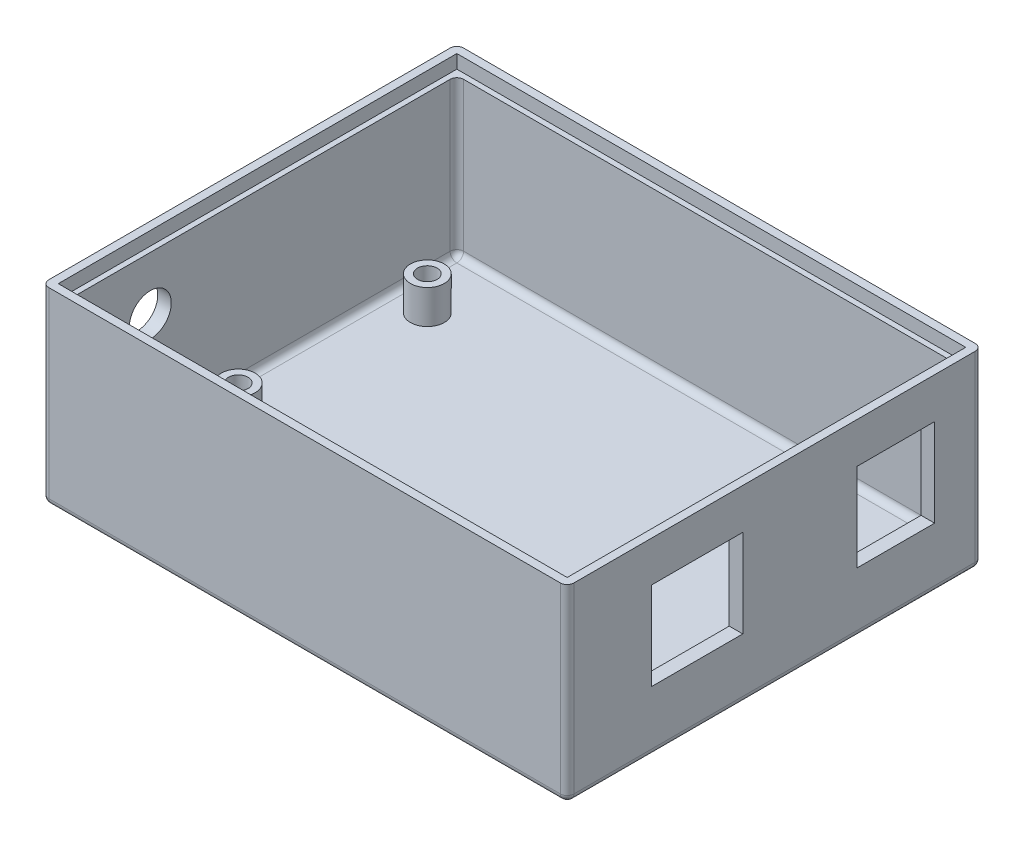
from build123d import *

# Parameters (mm, degrees)
SKETCH1_R                                         = 2.5
BOSS_EXTRUDE1_DEPTH                               = 5
BOSS_EXTRUDE1_2_DEPTH                             = 5
BOSS_EXTRUDE1_3_DEPTH                             = 5
BOSS_EXTRUDE1_4_DEPTH                             = 5
SKETCH3_W                                         = 77.6
SKETCH3_H                                         = 61.3
BOSS_EXTRUDE2_DEPTH                               = 3
SKETCH4_W                                         = 77.6
SKETCH4_H                                         = 61.3
SKETCH4_W_2                                       = 73.6
SKETCH4_H_2                                       = 57.3
BOSS_EXTRUDE3_DEPTH                               = 25
CUT_EXTRUDE2_REACH                                = 87.797
SKETCH5_W                                         = 13.5
SKETCH5_H                                         = 13
SKETCH5_W_2                                       = 11.5
FILLET1_R                                         = 1
SKETCH7_W                                         = 75.2
SKETCH7_H                                         = 58.9
CUT_EXTRUDE3_DEPTH                                = 2
SKETCH2_R                                         = 1
CUT_EXTRUDE1_DEPTH                                = 55.069053071
CSK_FOR_M2_5_FLAT_HEAD_MACHINE_SCREW1_D           = 2.9
CSK_FOR_M2_5_FLAT_HEAD_MACHINE_SCREW1_CSINK_D     = 5.5
CSK_FOR_M2_5_FLAT_HEAD_MACHINE_SCREW1_CSINK_ANGLE = 90
SKETCH12_R                                        = 3.1
CUT_EXTRUDE4_DEPTH                                = 2
FILLET3_R                                         = 1
FILLET4_R                                         = 1


with BuildPart() as part:
    # Sketch1 → Boss-Extrude1 (new body)
    with BuildSketch(Plane(origin=(0, 0, 0), x_dir=(1, 0, 0), z_dir=(0, 1, 0))):
        with Locations(Location((-32.6, 19.09, 0), (0, 0, 270))):
            Circle(SKETCH1_R)
    extrude(amount=-BOSS_EXTRUDE1_DEPTH)



with BuildPart() as body_2:
    # Sketch1 → Boss-Extrude1 2 (new body)
    with BuildSketch(Plane(origin=(0, 0, 0), x_dir=(1, 0, 0), z_dir=(0, 1, 0))):
        with Locations(Location((-32.6, -8.85, 0), (0, 0, 270))):
            Circle(SKETCH1_R)
    extrude(amount=-BOSS_EXTRUDE1_2_DEPTH)


with BuildPart() as body_3:
    # Sketch1 → Boss-Extrude1 3 (new body)
    with BuildSketch(Plane(origin=(0, 0, 0), x_dir=(1, 0, 0), z_dir=(0, 1, 0))):
        with Locations(Location((19.8, 24.15, 0), (0, 0, 270))):
            Circle(SKETCH1_R)
    extrude(amount=-BOSS_EXTRUDE1_3_DEPTH)


with BuildPart() as body_4:
    # Sketch1 → Boss-Extrude1 4 (new body)
    with BuildSketch(Plane(origin=(0, 0, 0), x_dir=(1, 0, 0), z_dir=(0, 1, 0))):
        with Locations(Location((18.5, -24.05, 0), (0, 0, 270))):
            Circle(SKETCH1_R)
    extrude(amount=-BOSS_EXTRUDE1_4_DEPTH)


with BuildPart() as part_1:
    add(part.part)

    add(body_2.part)  # Boss-Extrude2 merges body 2

    add(body_3.part)  # Boss-Extrude2 merges body 3

    add(body_4.part)  # Boss-Extrude2 merges body 4
    # Sketch3 → Boss-Extrude2 (add)
    with BuildSketch(Plane.XZ.offset(5)):
        with Locations((-1, 0)):
            Rectangle(SKETCH3_W, SKETCH3_H)
    extrude(amount=BOSS_EXTRUDE2_DEPTH)

    # Sketch4 → Boss-Extrude3 (add)
    with BuildSketch(Plane(origin=(0, -5, 0), x_dir=(1, 0, 0), z_dir=(0, 1, 0))):
        with Locations((-1, 0)):
            Rectangle(SKETCH4_W, SKETCH4_H)
        with Locations((-1, 0)):
            Rectangle(SKETCH4_W_2, SKETCH4_H_2, mode=Mode.SUBTRACT)
    extrude(amount=BOSS_EXTRUDE3_DEPTH)

    # Sketch5 → Cut-Extrude2 (cut, up to next)
    with BuildSketch(Plane(origin=(37.8, 0, 0), x_dir=(0, 0, -1), z_dir=(1, 0, 0)), mode=Mode.PRIVATE) as cut_extrude2_sk1:
        with Locations((-11.45, 7.5)):
            Rectangle(SKETCH5_W, SKETCH5_H)
    cut_extrude2_tool1 = extrude(cut_extrude2_sk1.sketch, amount=-CUT_EXTRUDE2_REACH, mode=Mode.PRIVATE) & part_1.part
    # Sketch5 → Cut-Extrude2 (cut, up to next)
    with BuildSketch(Plane(origin=(37.8, 0, 0), x_dir=(0, 0, -1), z_dir=(1, 0, 0)), mode=Mode.PRIVATE) as cut_extrude2_sk2:
        with Locations((17.9, 7.5)):
            Rectangle(SKETCH5_W_2, SKETCH5_H)
    cut_extrude2_tool2 = extrude(cut_extrude2_sk2.sketch, amount=-CUT_EXTRUDE2_REACH, mode=Mode.PRIVATE) & part_1.part
    add(cut_extrude2_tool1.solids().sort_by_distance((37.8, 7.5, 11.45))[0], mode=Mode.SUBTRACT)
    add(cut_extrude2_tool2.solids().sort_by_distance((37.8, 7.5, -17.9))[0], mode=Mode.SUBTRACT)

    # Fillet1
    fillet1_edges = [part_1.edges().sort_by_distance(p)[0] for p in [
        (-1, -5, 28.65),
        (-1, -5, -28.65),
        (-37.8, -5, 0),
        (35.8, 7.5, -28.65),
        (-37.8, 7.5, -28.65),
        (-37.8, 7.5, 28.65),
        (35.8, 7.5, 28.65),
        (37.8, -8, 0),
    ]]
    fillet(fillet1_edges, radius=FILLET1_R)

    # Sketch7 → Cut-Extrude3 (cut)
    with BuildSketch(Plane(origin=(0, 20, 0), x_dir=(1, 0, 0), z_dir=(0, 1, 0))):
        with Locations((-1, 0)):
            Rectangle(SKETCH7_W, SKETCH7_H)
    extrude(amount=-CUT_EXTRUDE3_DEPTH, mode=Mode.SUBTRACT)

    # Sketch2 → Cut-Extrude1 (cut, through all)
    with BuildSketch(Plane(origin=(0, 0, 0), x_dir=(1, 0, 0), z_dir=(0, 1, 0))):
        with Locations(Location((-32.6, -8.85, 0), (0, 0, 270))):
            Circle(SKETCH2_R)
        with Locations(Location((-32.6, 19.09, 0), (0, 0, 270))):
            Circle(SKETCH2_R)
        with Locations(Location((19.8, 24.15, 0), (0, 0, 270))):
            Circle(SKETCH2_R)
        with Locations(Location((18.5, -24.05, 0), (0, 0, 270))):
            Circle(SKETCH2_R)
    extrude(amount=-CUT_EXTRUDE1_DEPTH, mode=Mode.SUBTRACT)

    # CSK for M2.5 Flat Head Machine Screw1 (through all)
    with Locations(Plane(origin=(0, -8, 0), x_dir=(-1, 0, 0), z_dir=(0, -1, 0))):
        with Locations((32.6, 19.09), (32.6, -8.85), (-18.5, -24.05), (-19.8, 24.15)):
            CounterSinkHole(CSK_FOR_M2_5_FLAT_HEAD_MACHINE_SCREW1_D / 2, CSK_FOR_M2_5_FLAT_HEAD_MACHINE_SCREW1_CSINK_D / 2, counter_sink_angle=CSK_FOR_M2_5_FLAT_HEAD_MACHINE_SCREW1_CSINK_ANGLE)

    # Sketch12 → Cut-Extrude4 (cut)
    with BuildSketch(Plane.ZY.offset(39.8)):
        with Locations((16.65, 10)):
            Circle(SKETCH12_R)
    extrude(amount=-CUT_EXTRUDE4_DEPTH, mode=Mode.SUBTRACT)

    # Fillet3
    fillet3_edges = [part_1.edges().sort_by_distance(p)[0] for p in [
        (-39.8, 6, 30.65),
        (-39.8, 6, -30.65),
        (-1.5, -8, -30.65),
        (-1.5, -8, 30.65),
        (37.8, 6.5, 30.65),
        (37.507106781, -7.707106781, 30.65),
        (37.8, 6.5, -30.65),
        (37.507106781, -7.707106781, -30.65),
    ]]
    fillet(fillet3_edges, radius=FILLET3_R)

    # Fillet4
    # the kernel refuses this fillet: 1 mm, written as the material it takes off along each edge
    with BuildSketch(Plane(origin=(-38.8, -7, -29.65), x_dir=(0, -1, 0), z_dir=(-1, 0, 0))) as fillet4_piece_1_section:
        Polygon((0, 0), (FILLET4_R, 0), (FILLET4_R, -FILLET4_R), (0, -FILLET4_R), align=None)
    fillet4_piece_1 = extrude(amount=FILLET4_R, mode=Mode.PRIVATE)
    fillet4_piece_1 = fillet4_piece_1 - Plane(origin=(-38.8, -7, -29.65), x_dir=(0, 0.7071067811865475, 0.7071067811865475), z_dir=(-1, 0, 0)) * Sphere(FILLET4_R, mode=Mode.PRIVATE)
    add(fillet4_piece_1, mode=Mode.SUBTRACT)
    with BuildSketch(Plane(origin=(-38.8, -7, 29.65), x_dir=(0, -1, 0), z_dir=(-1, 0, 0))) as fillet4_piece_2_section:
        Polygon((0, 0), (FILLET4_R, 0), (FILLET4_R, FILLET4_R), (0, FILLET4_R), align=None)
    fillet4_piece_2 = extrude(amount=FILLET4_R, mode=Mode.PRIVATE)
    fillet4_piece_2 = fillet4_piece_2 - Plane(origin=(-38.8, -7, 29.65), x_dir=(0, 0.7071067811865475, -0.7071067811865475), z_dir=(-1, 0, 0)) * Sphere(FILLET4_R, mode=Mode.PRIVATE)
    add(fillet4_piece_2, mode=Mode.SUBTRACT)
    with BuildSketch(Plane(origin=(-39.8, -8, -29.65), x_dir=(0, 1, 0), z_dir=(0, 0, 1))) as fillet4_piece_3:
        with BuildLine():
            CenterArc((FILLET4_R, -FILLET4_R), FILLET4_R, 90, 90)
            Line((0, -FILLET4_R), (0, 0))
            Line((0, 0), (FILLET4_R, 0))
        make_face()
    extrude(amount=59.3, mode=Mode.SUBTRACT)


solid = part_1.part
